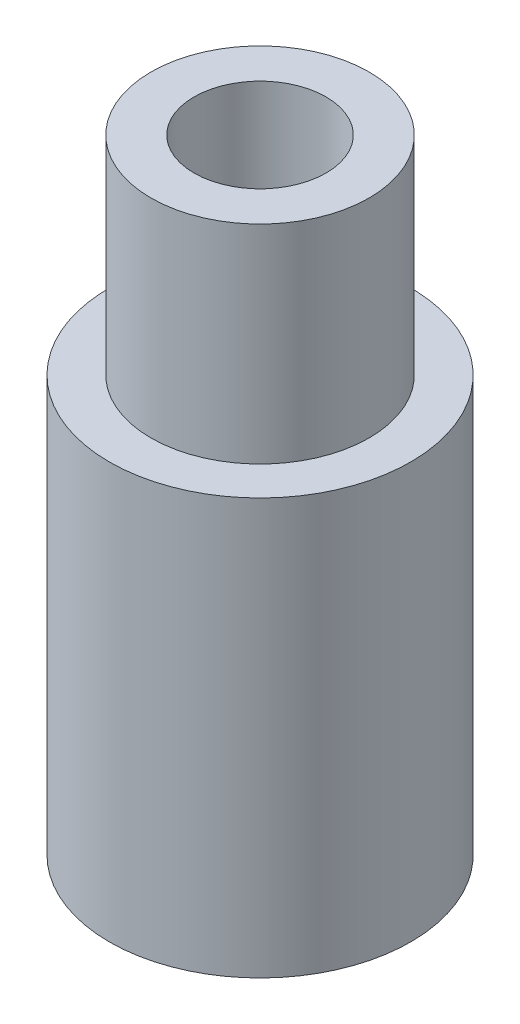
from build123d import *

# Parameters (mm, degrees)
SKETCH1_R           = 7.25
SKETCH1_R_2         = 3.175
BOSS_EXTRUDE1_DEPTH = 30
SKETCH2_OUTSIDE_W   = 23.768
SKETCH2_OUTSIDE_H   = 23.768
SKETCH2_OUTSIDE_R   = 5.25
CUT_EXTRUDE1_DEPTH  = 10
SKETCH3_R           = 4.25
CUT_EXTRUDE2_DEPTH  = 9


with BuildPart() as part:
    # Sketch1 → Boss-Extrude1 (new body)
    with BuildSketch(Plane(origin=(0, 0, 0), x_dir=(1, 0, 0), z_dir=(0, 1, 0))):
        Circle(SKETCH1_R)
        Circle(SKETCH1_R_2, mode=Mode.SUBTRACT)
    extrude(amount=BOSS_EXTRUDE1_DEPTH)

    # Sketch2 outside → Cut-Extrude1 (cut)
    with BuildSketch(Plane(origin=(0, 30, 0), x_dir=(1, 0, 0), z_dir=(0, 1, 0))):
        Rectangle(SKETCH2_OUTSIDE_W, SKETCH2_OUTSIDE_H)
        Circle(SKETCH2_OUTSIDE_R, mode=Mode.SUBTRACT)
    extrude(amount=-CUT_EXTRUDE1_DEPTH, mode=Mode.SUBTRACT)

    # Sketch3 → Cut-Extrude2 (cut)
    with BuildSketch(Plane.XZ):
        Circle(SKETCH3_R)
    extrude(amount=-CUT_EXTRUDE2_DEPTH, mode=Mode.SUBTRACT)


solid = part.part
